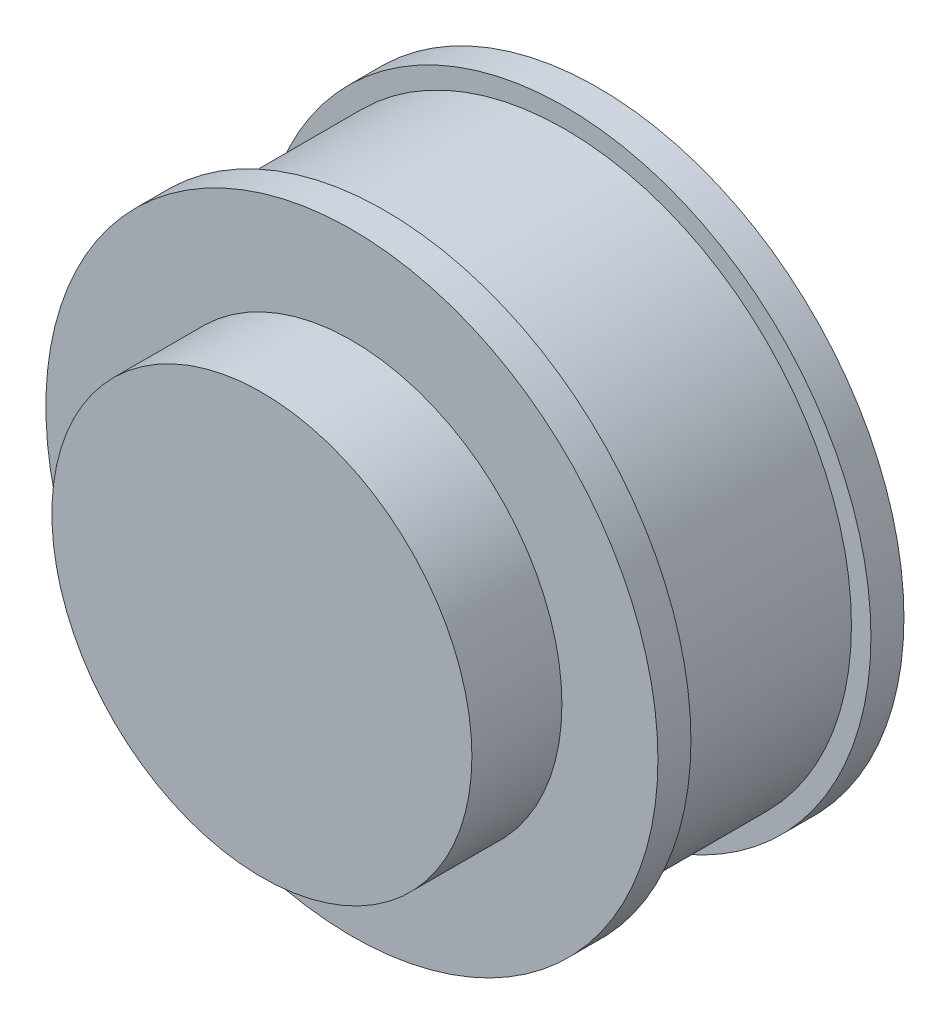
from build123d import *

# Parameters (mm, degrees)
SZKIC1_R                    = 23.875
DODANIE_WYCI_GNI_CIE1_DEPTH = 20.5
SZKIC2_R                    = 17.5
DODANIE_WYCI_GNI_CIE2_DEPTH = 7.5
SZKIC3_R                    = 25.5
DODANIE_WYCI_GNI_CIE3_DEPTH = 2.75
SZYK_LINIOWY1_COUNT         = 2
SZYK_LINIOWY1_PITCH         = 17.75


with BuildPart() as part:
    # Szkic1 → Dodanie-wyciągnięcie1 (new body)
    with BuildSketch(Plane.XY):
        Circle(SZKIC1_R)
    extrude(amount=DODANIE_WYCI_GNI_CIE1_DEPTH)

    # Szkic2 → Dodanie-wyciągnięcie2 (add)
    with BuildSketch(Plane.XY.offset(20.5)):
        Circle(SZKIC2_R)
    extrude(amount=DODANIE_WYCI_GNI_CIE2_DEPTH)

    # Szkic3 → Dodanie-wyciągnięcie3 (add)
    with BuildSketch(Plane.XY.offset(20.5)):
        Circle(SZKIC3_R)
    dodanie_wyci_gni_cie3 = extrude(amount=-DODANIE_WYCI_GNI_CIE3_DEPTH)

    # Szyk liniowy1: Dodanie-wyciągnięcie3 ×2
    with Locations(*[(0, 0, -i * SZYK_LINIOWY1_PITCH) for i in range(1, SZYK_LINIOWY1_COUNT)]):
        add(dodanie_wyci_gni_cie3)


solid = part.part
